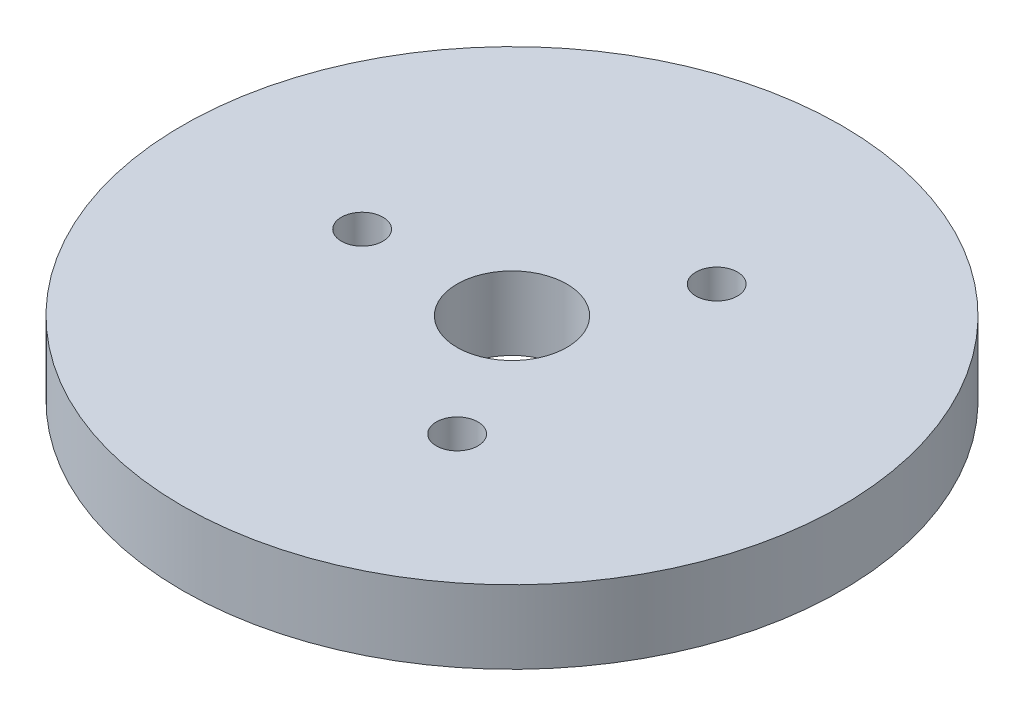
from build123d import *

# Parameters (mm, degrees)
SKETCH1_R           = 90
BOSS_EXTRUDE1_DEPTH = 20
SKETCH2_R           = 15
CUT_EXTRUDE1_DEPTH  = 129.840987267
SKETCH3_R           = 5.685481476
CUT_EXTRUDE2_DEPTH  = 18.088257883
CIRPATTERN1_COUNT   = 3


with BuildPart() as part:
    # Sketch1 → Boss-Extrude1 (new body)
    with BuildSketch(Plane(origin=(0, 0, 0), x_dir=(1, 0, 0), z_dir=(0, 1, 0))):
        Circle(SKETCH1_R)
    extrude(amount=BOSS_EXTRUDE1_DEPTH)

    # Sketch2 → Cut-Extrude1 (cut, through all)
    with BuildSketch(Plane(origin=(0, 0, 0), x_dir=(1, 0, 0), z_dir=(0, 1, 0))):
        Circle(SKETCH2_R)
    extrude(amount=CUT_EXTRUDE1_DEPTH, mode=Mode.SUBTRACT)

    # Sketch3 → Cut-Extrude2 (cut)
    with BuildSketch(Plane(origin=(0, 20, 0), x_dir=(1, 0, 0), z_dir=(0, 1, 0))):
        with Locations((-40.92256954, 0)):
            Circle(SKETCH3_R)
    cut_extrude2 = extrude(amount=-CUT_EXTRUDE2_DEPTH, mode=Mode.SUBTRACT)

    # CirPattern1: Cut-Extrude2 ×3 about axis
    cirpattern1_axis = Axis((0, 0, 0), (0, 1, 0))
    for i in range(1, CIRPATTERN1_COUNT):
        add(cut_extrude2.rotate(cirpattern1_axis, i * 360 / CIRPATTERN1_COUNT), mode=Mode.SUBTRACT)


solid = part.part
